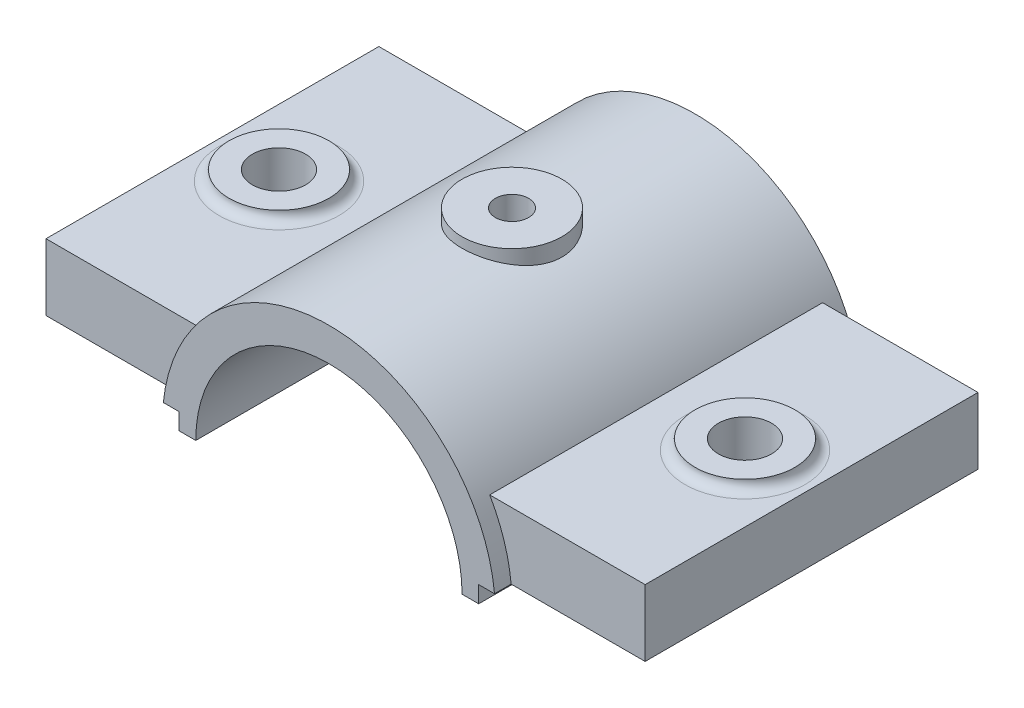
from build123d import *

# Parameters (mm, degrees)
BOSS_EXTRUDE1_DEPTH      = 55
SKETCH2_W                = 180
SKETCH2_H                = 20
BOSS_EXTRUDE2_DEPTH      = 50
SKETCH3_W                = 5
SKETCH3_H                = 5
CUT_EXTRUDE1_DEPTH       = 151.665191733
CUT_EXTRUDE2_DEPTH       = 151.665191733
CUT_EXTRUDE2_DEPTH_BACK  = 151.665191733
SKETCH5_R                = 15
BOSS_EXTRUDE3_DEPTH      = 3
BOSS_EXTRUDE4_REACH      = 120.042
BOSS_EXTRUDE4_END_RADIUS = 50
SKETCH6_R                = 15
HOLE1_D                  = 10
HOLE2_D                  = 16
FILLET1_R                = 3
SKETCH11_R               = 8
CUT_EXTRUDE3_DEPTH       = 42


with BuildPart() as part:
    # Sketch1 → Boss-Extrude1 (new, symmetric)
    with BuildSketch(Plane.XY):
        with BuildLine():
            Line((-50, 0), (50, 0))
            ThreePointArc((50, 0), (0, 50), (-50, 0))
        make_face()
    extrude(amount=BOSS_EXTRUDE1_DEPTH, both=True)

    # Sketch2 → Boss-Extrude2 (add, symmetric)
    with BuildSketch(Plane.XY):
        with Locations((0, 15)):
            Rectangle(SKETCH2_W, SKETCH2_H)
    extrude(amount=BOSS_EXTRUDE2_DEPTH, both=True)

    # Sketch3 → Cut-Extrude1 (cut, symmetric)
    with BuildSketch(Plane.XY.offset(55)):
        with Locations((47.5, 2.5)):
            Rectangle(SKETCH3_W, SKETCH3_H)
    cut_extrude1 = extrude(amount=CUT_EXTRUDE1_DEPTH, both=True, mode=Mode.SUBTRACT)

    # Mirror1: Cut-Extrude1 across plane
    add(cut_extrude1.mirror(Plane(origin=(0, 0, 0), x_dir=(0, 0, 1), z_dir=(1, 0, 0))), mode=Mode.SUBTRACT)

    # Sketch4 → Cut-Extrude2 (cut, two sides: drawn at the far end of the back side and taken through both)
    with BuildSketch(Plane.XY.offset(55).offset(-CUT_EXTRUDE2_DEPTH_BACK)):
        with BuildLine():
            Line((40, 0), (-40, 0))
            ThreePointArc((-40, 0), (0, 40), (40, 0))
        make_face()
    extrude(amount=CUT_EXTRUDE2_DEPTH + CUT_EXTRUDE2_DEPTH_BACK, mode=Mode.SUBTRACT)

    # Sketch5 → Boss-Extrude3 (add)
    with BuildSketch(Plane(origin=(0, 25, 0), x_dir=(1, 0, 0), z_dir=(0, 1, 0))):
        with Locations(Location((-70, 0, 0), (0, 0, 90))):
            Circle(SKETCH5_R)
    boss_extrude3 = extrude(amount=BOSS_EXTRUDE3_DEPTH)

    # Mirror2: Boss-Extrude3 across plane
    add(boss_extrude3.mirror(Plane(origin=(0, 0, 0), x_dir=(0, 0, 1), z_dir=(1, 0, 0))))

    # Boss-Extrude4: up to this cylinder (the profile starts outside it)
    boss_extrude4_end = Plane(origin=(0, 0, 0), z_dir=(0, 0, -1)) * Cylinder(BOSS_EXTRUDE4_END_RADIUS, 341.084, mode=Mode.PRIVATE)
    # Sketch6 → Boss-Extrude4 (add, up to the surface)
    with BuildSketch(Plane(origin=(0, 53, 0), x_dir=(1, 0, 0), z_dir=(0, 1, 0)), mode=Mode.PRIVATE) as boss_extrude4_sk1:
        with Locations(Location((0, 0, 0), (0, 0, 270))):
            Circle(SKETCH6_R)
    boss_extrude4_tool1 = extrude(boss_extrude4_sk1.sketch, amount=-BOSS_EXTRUDE4_REACH, mode=Mode.PRIVATE) - boss_extrude4_end
    add(boss_extrude4_tool1.solids().sort_by_distance((0, 53, 0))[0])

    # Hole1 (through all)
    with Locations(Plane(origin=(0, 53, 0), x_dir=(1, 0, 0), z_dir=(0, 1, 0))):
        with Locations((0, 0)):
            Hole(HOLE1_D / 2)

    # Hole2 (through all)
    with Locations(Plane(origin=(0, 28, 0), x_dir=(1, 0, 0), z_dir=(0, 1, 0))):
        with Locations((-70, 0), (70, 0)):
            Hole(HOLE2_D / 2)

    # Fillet1
    fillet1_edges = [part.edges().sort_by_distance(p)[0] for p in [
        (-70, 25, 15),
        (70, 25, 15),
    ]]
    fillet(fillet1_edges, radius=FILLET1_R - 0.0001)  # a hair under: the kernel refuses the full size

    # Sketch11 → Cut-Extrude3 (cut)
    with BuildSketch(Plane(origin=(0, 0, 0), x_dir=(1, 0, 0), z_dir=(0, 1, 0))):
        with Locations(Location((0, 0, 0), (0, 0, 90))):
            Circle(SKETCH11_R)
    extrude(amount=CUT_EXTRUDE3_DEPTH, mode=Mode.SUBTRACT)


solid = part.part
